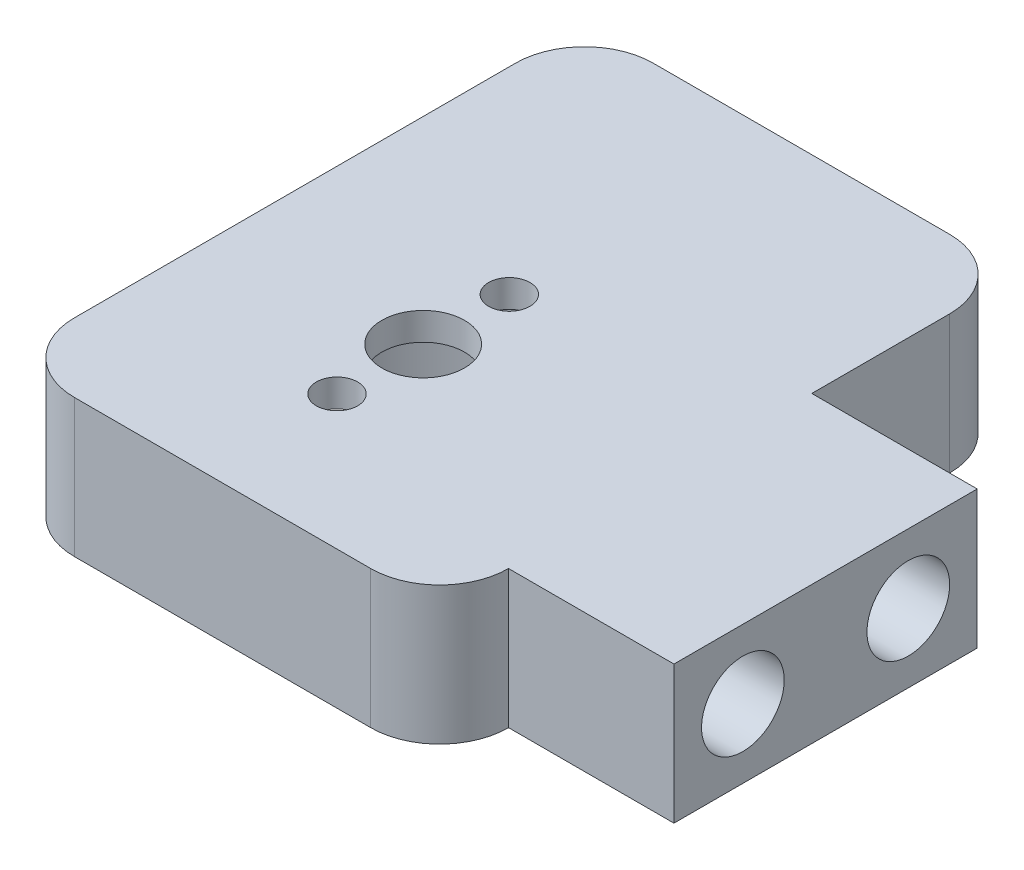
from build123d import *

# Parameters (mm, degrees)
BOSS_EXTRUDE1_DEPTH = 10
SKETCH2_R           = 3
CUT_EXTRUDE1_DEPTH  = 10
SKETCH4_R           = 11
CUT_EXTRUDE3_DEPTH  = 8
SKETCH5_R           = 3
SKETCH5_R_2         = 1.5
CUT_EXTRUDE4_DEPTH  = 8
SKETCH7_W           = 21.5
SKETCH7_H           = 2
BOSS_EXTRUDE2_DEPTH = 12
FILLET1_R           = 5
SKETCH8_R           = 3
CUT_EXTRUDE5_DEPTH  = 20
FILLET2_R           = 5


with BuildPart() as part:
    # Sketch1 → Boss-Extrude1 (new body)
    with BuildSketch(Plane(origin=(0, 0, 0), x_dir=(1, 0, 0), z_dir=(0, 1, 0))):
        Polygon((5.5, 11), (5.5, 26), (-26, 26), (-26, -16), (5.5, -16), (5.5, -11), (17.5, -11), (17.5, 11), align=None)
    extrude(amount=BOSS_EXTRUDE1_DEPTH)

    # Sketch2 → Cut-Extrude1 (cut)
    with BuildSketch(Plane(origin=(17.5, 0, 0), x_dir=(0, 0, -1), z_dir=(1, 0, 0))):
        with Locations((-6, 5)):
            Circle(SKETCH2_R)
        with Locations((6, 5)):
            Circle(SKETCH2_R)
    extrude(amount=-CUT_EXTRUDE1_DEPTH, mode=Mode.SUBTRACT)

    # Sketch4 → Cut-Extrude3 (cut)
    with BuildSketch(Plane.XZ):
        with Locations(Location((-11.695464036, 0, 0), (0, 0, 270))):
            Circle(SKETCH4_R)
    extrude(amount=-CUT_EXTRUDE3_DEPTH, mode=Mode.SUBTRACT)

    # Sketch5 → Cut-Extrude4 (cut)
    with BuildSketch(Plane(origin=(0, 8, 0), x_dir=(-1, 0, 0), z_dir=(0, -1, 0))):
        with Locations(Location((11.695464036, 0, 0), (0, 0, 90))):
            Circle(SKETCH5_R)
        with Locations(Location((11.695464036, -6.25, 0), (0, 0, 90))):
            Circle(SKETCH5_R_2)
        with Locations(Location((11.695464036, 6.25, 0), (0, 0, 90))):
            Circle(SKETCH5_R_2)
    extrude(amount=-CUT_EXTRUDE4_DEPTH, mode=Mode.SUBTRACT)

    # Sketch7 → Boss-Extrude2 (add)
    with BuildSketch(Plane(origin=(0, 0, 0), x_dir=(-1, 0, 0), z_dir=(0, -1, 0))):
        with Locations((10.25, 25)):
            Rectangle(SKETCH7_W, SKETCH7_H)
    extrude(amount=BOSS_EXTRUDE2_DEPTH)

    # Fillet1
    fillet1_edges = [part.edges().sort_by_distance(p)[0] for p in [
        (-26, 5, -26),
        (5.5, 5, -26),
        (5.5, 5, 16),
        (-26, 5, 16),
    ]]
    fillet(fillet1_edges, radius=FILLET1_R - 0.0001)  # a hair under: the kernel refuses the full size

    # Sketch8 → Cut-Extrude5 (cut)
    with BuildSketch(Plane.XY.offset(-24)):
        with Locations((-16, -5)):
            Circle(SKETCH8_R)
        with Locations((-4.5, -5)):
            Circle(SKETCH8_R)
    extrude(amount=-CUT_EXTRUDE5_DEPTH, mode=Mode.SUBTRACT)

    # Fillet2
    fillet2_edges = [part.edges().sort_by_distance(p)[0] for p in [
        (0.5, -12, -25),
        (-21, -12, -25),
    ]]
    fillet(fillet2_edges, radius=FILLET2_R)


solid = part.part
